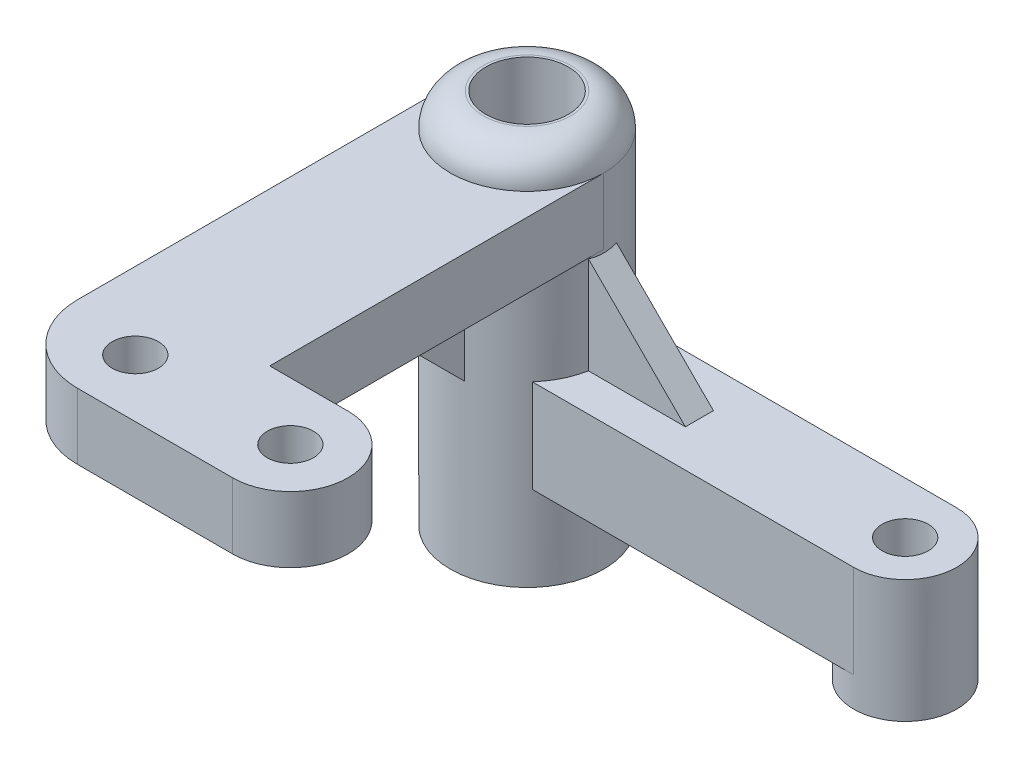
from build123d import *
from build123d.topology import SkipClean

# Parameters (mm, degrees)
SKETCH2_R           = 1.4
SKETCH2_R_2         = 2.5
BOSS_EXTRUDE1_DEPTH = 4
BOSS_EXTRUDE2_START = 16.8
SKETCH3_R           = 4.65
SKETCH3_R_2         = 2.5
BOSS_EXTRUDE2_DEPTH = 16.8
SKETCH5_R           = 4.65
SKETCH5_R_2         = 2.5
BOSS_EXTRUDE3_DEPTH = 2
FILLET1_R           = 2
RIB1_REACH          = 36.514
SKETCH6_WALL_W      = 80.220281068
SKETCH6_WALL_H      = 1.6
BOSS_EXTRUDE4_DEPTH = 5.65
SKETCH8_R           = 3.125
BOSS_EXTRUDE5_DEPTH = 1.8
SKETCH9_R           = 1.4
CUT_EXTRUDE1_DEPTH  = 43.420130834
RIB2_REACH          = 43.272
SKETCH10_WALL_W     = 92.747093244
SKETCH10_WALL_H     = 1.7


with BuildPart() as part:
    # Sketch2 → Boss-Extrude1 (new body)
    with BuildSketch(Plane(origin=(0, 0, 0), x_dir=(1, 0, 0), z_dir=(0, 1, 0))):
        with BuildLine():
            Line((-9.4, -4.65), (0, -4.65))
            ThreePointArc((0, -4.65), (3.288046533, -3.288046533), (4.65, 0))
            Line((4.65, 0), (4.65, 22.6))
            ThreePointArc((4.65, 22.6), (0, 27.25), (-4.65, 22.6))
            Line((-4.65, 22.6), (-4.65, 2.35))
            Line((-4.65, 2.35), (-9.4, 2.35))
            ThreePointArc((-9.4, 2.35), (-12.9, -1.15), (-9.4, -4.65))
        make_face()
        with Locations(Location((-9.4, -1.15, 0), (0, 0, 270))):
            Circle(SKETCH2_R, mode=Mode.SUBTRACT)
        with Locations(Location((0, -1.15, 0), (0, 0, 270))):
            Circle(SKETCH2_R, mode=Mode.SUBTRACT)
        with Locations(Location((0, 22.6, 0), (0, 0, 270))):
            Circle(SKETCH2_R_2, mode=Mode.SUBTRACT)
    extrude(amount=BOSS_EXTRUDE1_DEPTH)

    # Sketch3 → Boss-Extrude2 (add)
    with BuildSketch(Plane.XZ.offset(BOSS_EXTRUDE2_START)):
        with Locations((0, -22.6)):
            Circle(SKETCH3_R)
        with Locations(Location((0, -22.6, 0), (0, 0, 90))):
            Circle(SKETCH3_R_2, mode=Mode.SUBTRACT)
    extrude(amount=-BOSS_EXTRUDE2_DEPTH)

    # Sketch5 → Boss-Extrude3 (add)
    with SkipClean():  # the faces are left unmerged after this step: merging them gives an invalid solid
        with BuildSketch(Plane(origin=(0, 4, 0), x_dir=(1, 0, 0), z_dir=(0, 1, 0))):
            with Locations(Location((0, 22.6, 0), (0, 0, 270))):
                Circle(SKETCH5_R)
            with Locations(Location((0, 22.6, 0), (0, 0, 270))):
                Circle(SKETCH5_R_2, mode=Mode.SUBTRACT)
        extrude(amount=BOSS_EXTRUDE3_DEPTH)

    # Fillet1
    fillet1_edges = [part.edges().sort_by_distance(p)[0] for p in [
        (0, 6, -27.25),
    ]]
    fillet(fillet1_edges, radius=FILLET1_R - 0.0001)  # a hair under: the kernel refuses the full size

    # Sketch6 wall → Rib1 (add, up to next)
    with BuildSketch(Plane(origin=(0, -3.25, -14.7), x_dir=(0, -0.707106781187, -0.707106781187), z_dir=(0, 0.707106781187, -0.707106781187)), mode=Mode.PRIVATE) as rib1_sk1:
        Rectangle(SKETCH6_WALL_W, SKETCH6_WALL_H)
    rib1_tool1 = extrude(rib1_sk1.sketch, amount=RIB1_REACH, mode=Mode.PRIVATE) - part.part
    add(rib1_tool1.solids().sort_by_distance((0, -3.25, -14.7))[0])


with BuildPart() as body_2:
    # Mirror1: mirrored copy
    add(part.part.mirror(Plane(origin=(0, 0, 0), x_dir=(0, 0, 1), z_dir=(1, 0, 0))))

    # Sketch7 → Boss-Extrude4 (add)
    with BuildSketch(Plane(origin=(0, -6, 0), x_dir=(1, 0, 0), z_dir=(0, 1, 0))):
        with BuildLine():
            Line((22.925, 25.725), (3.443381332, 25.725))
            ThreePointArc((3.443381332, 25.725), (4.65, 22.6), (3.443381332, 19.475))
            Line((3.443381332, 19.475), (22.925, 19.475))
            ThreePointArc((22.925, 19.475), (26.05, 22.6), (22.925, 25.725))
        make_face()
    extrude(amount=-BOSS_EXTRUDE4_DEPTH)

    # Sketch8 → Boss-Extrude5 (add)
    with SkipClean():  # the faces are left unmerged after this step: merging them gives an invalid solid
        with BuildSketch(Plane.XZ.offset(11.65)):
            with Locations(Location((22.925, -22.6, 0), (0, 0, 270))):
                Circle(SKETCH8_R)
        extrude(amount=BOSS_EXTRUDE5_DEPTH)
    add(body_2.part.scale(1), mode=Mode.REPLACE)  # the faces are merged on a copy

    # Sketch9 → Cut-Extrude1 (cut, through all)
    with BuildSketch(Plane.XZ.offset(13.45)):
        with Locations(Location((22.925, -22.6, 0), (0, 0, 270))):
            Circle(SKETCH9_R)
    extrude(amount=-CUT_EXTRUDE1_DEPTH, mode=Mode.SUBTRACT)

    # Sketch10 wall → Rib2 (add, up to next)
    with BuildSketch(Plane(origin=(7.55, -3.1, -22.6), x_dir=(0.707106781187, -0.707106781187, 0), z_dir=(0.707106781187, 0.707106781187, 0)), mode=Mode.PRIVATE) as rib2_sk1:
        Rectangle(SKETCH10_WALL_W, SKETCH10_WALL_H)
    rib2_tool1 = extrude(rib2_sk1.sketch, amount=-RIB2_REACH, mode=Mode.PRIVATE) - body_2.part
    add(rib2_tool1.solids().sort_by_distance((7.55, -3.1, -22.6))[0])


solid = body_2.part
